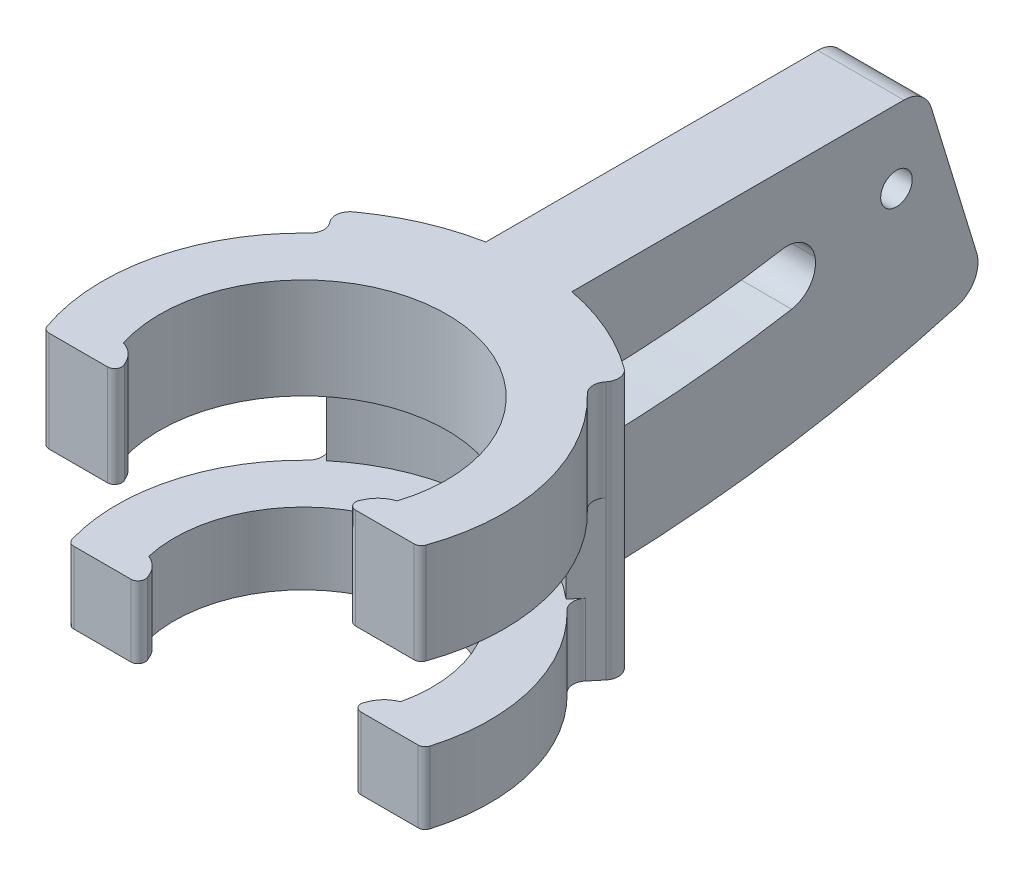
from build123d import *

# Parameters (mm, degrees)
SKETCH1_R              = 13
SKETCH1_R_2            = 9
BOSS_EXTRUDE1_DEPTH    = 5
SKETCH2_R              = 14
SKETCH2_R_2            = 10
BOSS_EXTRUDE2_DEPTH    = 7
CUT_EXTRUDE1_DEPTH     = 7
BOSS_EXTRUDE3_DEPTH    = 5
FILLET1_R              = 2
FILLET2_R              = 0.5
CUT_EXTRUDE2_DEPTH     = 9
BOSS_EXTRUDE4_DEPTH    = 7
FILLET3_R              = 2
FILLET4_R              = 0.5
BOSS_EXTRUDE5_START    = -18
BOSS_EXTRUDE5_DEPTH    = 18
BOSS_EXTRUDE6_START    = -18
BOSS_EXTRUDE6_DEPTH    = 18
SKETCH7_W              = 6
SKETCH7_H              = 18
BOSS_EXTRUDE7_DEPTH    = 28
FILLET5_R              = 1
CUT_EXTRUDE3_START     = -6
CUT_EXTRUDE3_OUTLINE_R = 1.1
CUT_EXTRUDE3_DEPTH     = 6
FILLET7_R              = 2


# Read off the part's stored shape, not the designer's step: Boss-Extrude6, Cut-Extrude3
# Some blends are built 0.0001 mm under size
with BuildPart() as part:
    # Sketch1 → Boss-Extrude1 (new body)
    with BuildSketch(Plane(origin=(0, 0, 0), x_dir=(1, 0, 0), z_dir=(0, 1, 0))):
        with Locations(Location((0, 0, 0), (0, 0, 270))):
            Circle(SKETCH1_R)
        with Locations(Location((0, 0, 0), (0, 0, 270))):
            Circle(SKETCH1_R_2, mode=Mode.SUBTRACT)
    extrude(amount=BOSS_EXTRUDE1_DEPTH)

    # Sketch3 → Cut-Extrude1 (cut)
    with BuildSketch(Plane.XZ):
        with BuildLine():
            ThreePointArc((12.369316877, 4), (0, 13), (-12.369316877, 4))
            Line((-12.369316877, 4), (-8.062257748, 4))
            ThreePointArc((-8.062257748, 4), (0, 9), (8.062257748, 4))
            Line((8.062257748, 4), (12.369316877, 4))
        make_face()
    extrude(amount=-CUT_EXTRUDE1_DEPTH, mode=Mode.SUBTRACT)

    # Sketch3<3> → Boss-Extrude3 (add)
    with BuildSketch(Plane.XZ):
        with BuildLine():
            Line((-7.215434845, 4), (-8.062257748, 4))
            ThreePointArc((-8.062257748, 4), (-8.477795251, 3.02109048), (-8.774964387, 2))
            Line((-8.774964387, 2), (-8.003905297, 2))
            ThreePointArc((-8.003905297, 2), (-7.675094696, 3.025792692), (-7.215434845, 4))
        make_face()
        with BuildLine():
            ThreePointArc((8.774964387, 2), (8.477795251, 3.02109048), (8.062257748, 4))
            Line((8.062257748, 4), (7.215434845, 4))
            ThreePointArc((7.215434845, 4), (7.675094696, 3.025792692), (8.003905297, 2))
            Line((8.003905297, 2), (8.774964387, 2))
        make_face()
    extrude(amount=-BOSS_EXTRUDE3_DEPTH)

    # Fillet1
    # the kernel refuses this fillet: 2 mm, written as the material it takes off along each edge
    with BuildSketch(Plane(origin=(8.003905297, -2.925457541, 2), x_dir=(-0.3106184744402921, 0, 0.9505346723483502), z_dir=(0, 1, 0))) as fillet1_piece_1:
        with BuildLine():
            CenterArc((1.312023382, 1.994963987), FILLET1_R, 219.12562277, 46.807536055)
            Line((-0.239505198, 0.7329184), (-0.27053577, 0.707677488))
            ThreePointArc((-0.27053577, 0.707677488), (-0.157773986, 0.354034461), (-0.038021387, -0.012424739))
            Line((-0.038021387, -0.012424739), (0.002836807, -0.03989928))
            ThreePointArc((0.002836807, -0.03989928), (0.585091508, -0.019226448), (1.167346209, -0.03989928))
            Line((1.167346209, -0.03989928), (1.170183016, 0))
        make_face()
    extrude(amount=10.850915082, mode=Mode.SUBTRACT)
    with BuildSketch(Plane(origin=(-8.003905297, -2.925457541, 2), x_dir=(-1, 0, 0), z_dir=(0, 1, 0))) as fillet1_piece_2:
        with BuildLine():
            CenterArc((1.488743739, 1.866796386), FILLET1_R, 202.16334775, 46.807536055)
            Line((-0.363480463, 1.11229953), (-0.400524947, 1.097209593))
            ThreePointArc((-0.400524947, 1.097209593), (-0.200015637, 0.550177675), (-0.038806814, -0.00969697))
            Line((-0.038806814, -0.00969697), (0, -0.04))
            ThreePointArc((0, -0.04), (0.385529545, -0.04), (0.756705398, -0.037335928))
            Line((0.756705398, -0.037335928), (0.771059091, 0))
        make_face()
    extrude(amount=10.850915082, mode=Mode.SUBTRACT)

    # Fillet2
    fillet2_edges = [part.edges().sort_by_distance(p)[0] for p in [
        (-12.369316877, 2.5, 4),
        (12.369316877, 2.5, 4),
        (-7.215434845, 2.5, 4),
        (7.215434845, 2.5, 4),
    ]]
    fillet(fillet2_edges, radius=FILLET2_R)



with BuildPart() as body_2:
    # Sketch2 → Boss-Extrude2 (new body)
    with BuildSketch(Plane(origin=(0, 11, 0), x_dir=(1, 0, 0), z_dir=(0, 1, 0))):
        with Locations(Location((0, 0, 0), (0, 0, 270))):
            Circle(SKETCH2_R)
        with Locations(Location((0, 0, 0), (0, 0, 270))):
            Circle(SKETCH2_R_2, mode=Mode.SUBTRACT)
    extrude(amount=BOSS_EXTRUDE2_DEPTH)

    # Sketch4 → Cut-Extrude2 (cut)
    with BuildSketch(Plane.XZ.offset(-11)):
        with BuildLine():
            ThreePointArc((13.076696831, 5), (0, 14), (-13.076696831, 5))
            Line((-13.076696831, 5), (-8.660254038, 5))
            ThreePointArc((-8.660254038, 5), (0, 10), (8.660254038, 5))
            Line((8.660254038, 5), (13.076696831, 5))
        make_face()
    extrude(amount=-CUT_EXTRUDE2_DEPTH, mode=Mode.SUBTRACT)

    # Sketch4<3> → Boss-Extrude4 (add)
    with BuildSketch(Plane.XZ.offset(-11)):
        with BuildLine():
            Line((-7.782191208, 5), (-8.660254038, 5))
            ThreePointArc((-8.660254038, 5), (-9.154604257, 4.02408013), (-9.539392014, 3))
            Line((-9.539392014, 3), (-8.75, 3))
            ThreePointArc((-8.75, 3), (-8.326363944, 4.029164115), (-7.782191208, 5))
        make_face()
        with BuildLine():
            ThreePointArc((9.539392014, 3), (9.154604257, 4.02408013), (8.660254038, 5))
            Line((8.660254038, 5), (7.782191208, 5))
            ThreePointArc((7.782191208, 5), (8.326363944, 4.029164115), (8.75, 3))
            Line((8.75, 3), (9.539392014, 3))
        make_face()
    extrude(amount=-BOSS_EXTRUDE4_DEPTH)

    # Fillet3
    # the kernel refuses this fillet: 2 mm, written as the material it takes off along each edge
    with BuildSketch(Plane(origin=(-8.75, 8.186857883, 3), x_dir=(-1, 0, 0), z_dir=(0, 1, 0))) as fillet3_piece_1:
        with BuildLine():
            CenterArc((1.370115418, 1.913833934), FILLET3_R, 205.898945897, 47.221442291)
            Line((-0.429016212, 1.040263457), (-0.464998845, 1.022792048))
            ThreePointArc((-0.464998845, 1.022792048), (-0.235653724, 0.511411041), (-0.037837838, -0.012972973))
            Line((-0.037837838, -0.012972973), (0, -0.04))
            ThreePointArc((0, -0.04), (0.394696007, -0.04), (0.777777546, -0.038276679))
            Line((0.777777546, -0.038276679), (0.789392014, 0))
        make_face()
    extrude(amount=12.626284233, mode=Mode.SUBTRACT)
    with BuildSketch(Plane(origin=(8.75, 8.186857883, 3), x_dir=(-0.3812606993131178, 0, 0.9244675652283711), z_dir=(0, 1, 0))) as fillet3_piece_2:
        with BuildLine():
            CenterArc((1.246906235, 1.996296928), FILLET3_R, 219.291406968, 47.221442291)
            Line((-0.300964151, 0.729767313), (-0.331921559, 0.704436721))
            ThreePointArc((-0.331921559, 0.704436721), (-0.187460778, 0.349633229), (-0.036978703, -0.015250428))
            Line((-0.036978703, -0.015250428), (0.002432988, -0.039925939))
            ThreePointArc((0.002432988, -0.039925939), (0.562628423, -0.022873294), (1.122823859, -0.039925939))
            Line((1.122823859, -0.039925939), (1.125256847, 0))
        make_face()
    extrude(amount=12.626284233, mode=Mode.SUBTRACT)

    # Fillet4
    fillet4_edges = [body_2.edges().sort_by_distance(p)[0] for p in [
        (-13.076696831, 14.5, 5),
        (13.076696831, 14.5, 5),
        (-7.782191208, 14.5, 5),
        (7.782191208, 14.5, 5),
    ]]
    fillet(fillet4_edges, radius=FILLET4_R)


with BuildPart() as part_1:
    add(part.part)

    add(body_2.part)  # Boss-Extrude5 merges body 2
    # Sketch5 → Boss-Extrude5 (add)
    with BuildSketch(Plane(origin=(0, 18, 0), x_dir=(1, 0, 0), z_dir=(0, 1, 0)).offset(BOSS_EXTRUDE5_START)):
        with BuildLine():
            ThreePointArc((0, 14), (4.788282007, 13.155696691), (8.999026536, 10.724622204))
            Line((8.999026536, 10.724622204), (10.284601755, 12.25671109))
            ThreePointArc((10.284601755, 12.25671109), (0, 16), (-10.284601755, 12.25671109))
            Line((-10.284601755, 12.25671109), (-8.999026536, 10.724622204))
            ThreePointArc((-8.999026536, 10.724622204), (-4.788282007, 13.155696691), (0, 14))
        make_face()
        with BuildLine():
            ThreePointArc((0, 13), (4.446261863, 12.21600407), (8.356238926, 9.958577761))
            Line((8.356238926, 9.958577761), (8.999026536, 10.724622204))
            ThreePointArc((8.999026536, 10.724622204), (4.788282007, 13.155696691), (0, 14))
            Line((0, 14), (0, 13))
        make_face()
        with BuildLine():
            Line((-8.999026536, 10.724622204), (-8.356238926, 9.958577761))
            ThreePointArc((-8.356238926, 9.958577761), (-4.446261863, 12.21600407), (0, 13))
            Line((0, 13), (0, 14))
            ThreePointArc((0, 14), (-4.788282007, 13.155696691), (-8.999026536, 10.724622204))
        make_face()
    extrude(amount=BOSS_EXTRUDE5_DEPTH)

    # Boss-Extrude6 outline → Boss-Extrude6 (add)
    with BuildSketch(Plane(origin=(0, 18, 0), x_dir=(1, 0, 0), z_dir=(0, 1, 0)).offset(BOSS_EXTRUDE6_START)):
        with BuildLine():
            ThreePointArc((-3, 15.716233646), (0, 16), (3, 15.716233646))
            Line((3, 15.716233646), (3, 17.5))
            Line((3, 17.5), (-3, 17.5))
            Line((-3, 17.5), (-3, 15.716233646))
        make_face()
    extrude(amount=BOSS_EXTRUDE6_DEPTH)

    # Sketch7 → Boss-Extrude7 (add)
    with BuildSketch(Plane(origin=(0, 0, -17.5), x_dir=(-1, 0, 0), z_dir=(0, 0, -1))):
        with Locations((0, 9)):
            Rectangle(SKETCH7_W, SKETCH7_H)
    extrude(amount=BOSS_EXTRUDE7_DEPTH)

    # Fillet5
    fillet5_edges = [part_1.edges().sort_by_distance(p)[0] for p in [
        (-8.356238926, 2.5, -9.958577761),
        (-8.999026536, 14.5, -10.724622204),
        (8.356238926, 2.5, -9.958577761),
        (8.999026536, 14.5, -10.724622204),
        (10.284601755, 9, -12.25671109),
        (-10.284601755, 9, -12.25671109),
    ]]
    fillet(fillet5_edges, radius=FILLET5_R - 0.0001)  # a hair under: the kernel refuses the full size

    # Cut-Extrude3 outline → Cut-Extrude3 (cut)
    with BuildSketch(Plane.ZY.offset(3).offset(CUT_EXTRUDE3_START)):
        with BuildLine():
            ThreePointArc((-16.032782087, 0), (-30.438112209, 1.0880478), (-44.526972297, 4.282011691))
            Line((-44.526972297, 4.282011691), (-40.332962383, 18))
            Line((-40.332962383, 18), (-45.5, 18))
            Line((-45.5, 18), (-45.5, 0))
            Line((-45.5, 0), (-16.032782087, 0))
        make_face()
        with Locations((-38.338138622, 12.915422706)):
            Circle(CUT_EXTRUDE3_OUTLINE_R)
        with BuildLine():
            Line((-32.284081469, 13.580062224), (-33.04731745, 9.65355349))
            ThreePointArc((-33.04731745, 9.65355349), (-24.421849449, 8.406791821), (-15.716233646, 8.000139171))
            Line((-15.716233646, 8.000139171), (-15.716233646, 12.000145644))
            ThreePointArc((-15.716233646, 12.000145644), (-24.038466281, 12.388378225), (-32.284081469, 13.580062224))
        make_face()
    extrude(amount=CUT_EXTRUDE3_DEPTH, mode=Mode.SUBTRACT)

    # Fillet7
    fillet7_edges = [part_1.edges().sort_by_distance(p)[0] for p in [
        (0, 12.000145644, -15.716233646),
        (0, 8.000139171, -15.716233646),
        (0, 9.65355349, -33.04731745),
        (0, 13.580062224, -32.284081469),
        (0, 18, -40.332962383),
        (0, 4.282011691, -44.526972297),
    ]]
    fillet(fillet7_edges, radius=FILLET7_R - 0.0001)  # a hair under: the kernel refuses the full size


solid = part_1.part
